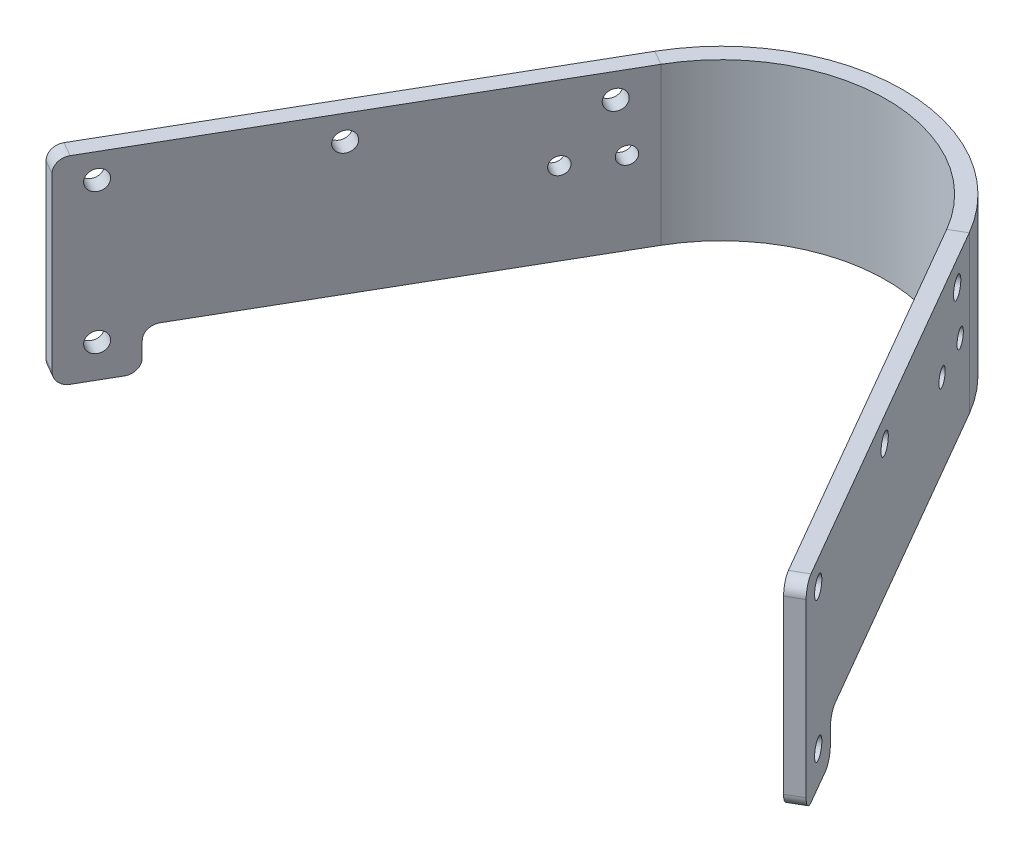
from build123d import *

# Parameters (mm, degrees)
BOSS_EXTRUDE10_DEPTH = 30.1625
SKETCH29_W           = 12.7
SKETCH29_H           = 7.9375
BOSS_EXTRUDE12_DEPTH = 6.35
CUT_EXTRUDE19_REACH  = 181.357
SKETCH30_R           = 1.651
CUT_EXTRUDE23_REACH  = 181.357
SKETCH38_R           = 1.905
FILLET24_R           = 2.54
CONVERT_SOLID1_DEPTH = 38.1


# Read off the part's stored shape, not the designer's step: Convert-Solid1
with BuildPart() as part:
    # Sketch28 → Boss-Extrude10 (new body)
    with BuildSketch(Plane(origin=(0, 38.1, 0), x_dir=(-1, 0, 0), z_dir=(0, -1, 0))):
        with BuildLine():
            Line((32.995567884, 114.3), (75.858067884, 40.059972261))
            Line((75.858067884, 40.059972261), (70.35880657, 36.884972261))
            Line((70.35880657, 36.884972261), (27.49630657, 111.125))
            ThreePointArc((27.49630657, 111.125), (0, 127), (-27.49630657, 111.125))
            Line((-27.49630657, 111.125), (-70.35880657, 36.884972261))
            Line((-70.35880657, 36.884972261), (-75.858067884, 40.059972261))
            Line((-75.858067884, 40.059972261), (-32.995567884, 114.3))
            ThreePointArc((-32.995567884, 114.3), (0, 133.35), (32.995567884, 114.3))
        make_face()
    extrude(amount=BOSS_EXTRUDE10_DEPTH)

    # Sketch29 → Boss-Extrude12 (add)
    with BuildSketch(Plane(origin=(-74.240027739, 0, -42.8625), x_dir=(-0.5, 0, 0.8660254037844387), z_dir=(-0.8660254037844387, 0, -0.5))):
        with Locations((-3.11391971, 3.96875)):
            Rectangle(SKETCH29_W, SKETCH29_H)
    boss_extrude12 = extrude(amount=-BOSS_EXTRUDE12_DEPTH)

    # Sketch30 → Cut-Extrude19 (cut, up to next)
    with BuildSketch(Plane(origin=(-74.240027739, 0, -42.8625), x_dir=(-0.5, 0, 0.8660254037844387), z_dir=(-0.8660254037844387, 0, -0.5)), mode=Mode.PRIVATE) as cut_extrude19_sk1:
        with Locations((-77.72641971, 23.8125)):
            Circle(SKETCH30_R)
    cut_extrude19_tool1 = extrude(cut_extrude19_sk1.sketch, amount=-CUT_EXTRUDE19_REACH, mode=Mode.PRIVATE) & part.part
    # Sketch30 → Cut-Extrude19 (cut, up to next)
    with BuildSketch(Plane(origin=(-74.240027739, 0, -42.8625), x_dir=(-0.5, 0, 0.8660254037844387), z_dir=(-0.8660254037844387, 0, -0.5)), mode=Mode.PRIVATE) as cut_extrude19_sk2:
        with Locations((-68.20141971, 23.8125)):
            Circle(SKETCH30_R)
    cut_extrude19_tool2 = extrude(cut_extrude19_sk2.sketch, amount=-CUT_EXTRUDE19_REACH, mode=Mode.PRIVATE) & part.part
    cut_extrude19_1 = cut_extrude19_tool1.solids().sort_by_distance((-35.376818, 23.8125, -110.175554))[0]
    add(cut_extrude19_1, mode=Mode.SUBTRACT)
    cut_extrude19_2 = cut_extrude19_tool2.solids().sort_by_distance((-40.139318, 23.8125, -101.926662))[0]
    add(cut_extrude19_2, mode=Mode.SUBTRACT)
    cut_extrude19 = cut_extrude19_1 + cut_extrude19_2  # Cut-Extrude19 as one shape, for the pattern or mirror that repeats it

    # Sketch38 → Cut-Extrude23 (cut, up to next)
    with BuildSketch(Plane(origin=(-74.240027739, 0, -42.8625), x_dir=(-0.5, 0, 0.8660254037844387), z_dir=(-0.8660254037844387, 0, -0.5)), mode=Mode.PRIVATE) as cut_extrude23_sk1:
        with Locations((-76.13891971, 33.3375)):
            Circle(SKETCH38_R)
    cut_extrude23_tool1 = extrude(cut_extrude23_sk1.sketch, amount=-CUT_EXTRUDE23_REACH, mode=Mode.PRIVATE) & part.part
    # Sketch38 → Cut-Extrude23 (cut, up to next)
    with BuildSketch(Plane(origin=(-74.240027739, 0, -42.8625), x_dir=(-0.5, 0, 0.8660254037844387), z_dir=(-0.8660254037844387, 0, -0.5)), mode=Mode.PRIVATE) as cut_extrude23_sk2:
        with Locations((-38.03891971, 33.3375)):
            Circle(SKETCH38_R)
    cut_extrude23_tool2 = extrude(cut_extrude23_sk2.sketch, amount=-CUT_EXTRUDE23_REACH, mode=Mode.PRIVATE) & part.part
    # Sketch38 → Cut-Extrude23 (cut, up to next)
    with BuildSketch(Plane(origin=(-74.240027739, 0, -42.8625), x_dir=(-0.5, 0, 0.8660254037844387), z_dir=(-0.8660254037844387, 0, -0.5)), mode=Mode.PRIVATE) as cut_extrude23_sk3:
        with Locations((-3.11391971, 33.3375)):
            Circle(SKETCH38_R)
    cut_extrude23_tool3 = extrude(cut_extrude23_sk3.sketch, amount=-CUT_EXTRUDE23_REACH, mode=Mode.PRIVATE) & part.part
    # Sketch38 → Cut-Extrude23 (cut, up to next)
    with BuildSketch(Plane(origin=(-74.240027739, 0, -42.8625), x_dir=(-0.5, 0, 0.8660254037844387), z_dir=(-0.8660254037844387, 0, -0.5)), mode=Mode.PRIVATE) as cut_extrude23_sk4:
        with Locations((-3.11391971, 6.35)):
            Circle(SKETCH38_R)
    cut_extrude23_tool4 = extrude(cut_extrude23_sk4.sketch, amount=-CUT_EXTRUDE23_REACH, mode=Mode.PRIVATE) & part.part
    cut_extrude23_1 = cut_extrude23_tool1.solids().sort_by_distance((-36.170568, 33.3375, -108.800739))[0]
    add(cut_extrude23_1, mode=Mode.SUBTRACT)
    cut_extrude23_2 = cut_extrude23_tool2.solids().sort_by_distance((-55.220568, 33.3375, -75.805171))[0]
    add(cut_extrude23_2, mode=Mode.SUBTRACT)
    cut_extrude23_3 = cut_extrude23_tool3.solids().sort_by_distance((-72.683068, 33.3375, -45.559234))[0]
    add(cut_extrude23_3, mode=Mode.SUBTRACT)
    cut_extrude23_4 = cut_extrude23_tool4.solids().sort_by_distance((-72.683068, 6.35, -45.559234))[0]
    add(cut_extrude23_4, mode=Mode.SUBTRACT)
    cut_extrude23 = cut_extrude23_1 + cut_extrude23_2 + cut_extrude23_3 + cut_extrude23_4  # Cut-Extrude23 as one shape, for the pattern or mirror that repeats it

    # Mirror7: Boss-Extrude12, Cut-Extrude19, Cut-Extrude23 across plane
    add(boss_extrude12.mirror(Plane(origin=(0, 0, 0), x_dir=(0, 0, 1), z_dir=(1, 0, 0))))
    add(cut_extrude19.mirror(Plane(origin=(0, 0, 0), x_dir=(0, 0, 1), z_dir=(1, 0, 0))), mode=Mode.SUBTRACT)
    add(cut_extrude23.mirror(Plane(origin=(0, 0, 0), x_dir=(0, 0, 1), z_dir=(1, 0, 0))), mode=Mode.SUBTRACT)

    # Fillet24
    fillet24_edges = [part.edges().sort_by_distance(p)[0] for p in [
        (73.108437227, 38.1, -38.472472261),
        (-73.108437227, 0, -38.472472261),
        (-66.758437227, 0, -49.470994889),
        (-66.758437227, 7.9375, -49.470994889),
        (73.108437227, 0, -38.472472261),
        (66.758437227, 7.9375, -49.470994889),
        (66.758437227, 0, -49.470994889),
        (-73.108437227, 38.1, -38.472472261),
    ]]
    fillet(fillet24_edges, radius=FILLET24_R)

    # Convert-Solid1 outline → Convert-Solid1 (cut)
    with BuildSketch(Plane(origin=(0, 0, 0), x_dir=(1, 0, 0), z_dir=(0, 1, 0))):
        with BuildLine():
            ThreePointArc((-30.245937227, 112.7125), (0, 130.175), (30.245937227, 112.7125))
            Line((30.245937227, 112.7125), (73.108437227, 38.472472261))
            Line((73.108437227, 38.472472261), (75.858067884, 40.059972261))
            Line((75.858067884, 40.059972261), (32.995567884, 114.3))
            ThreePointArc((32.995567884, 114.3), (0, 133.35), (-32.995567884, 114.3))
            Line((-32.995567884, 114.3), (-75.858067884, 40.059972261))
            Line((-75.858067884, 40.059972261), (-73.108437227, 38.472472261))
            Line((-73.108437227, 38.472472261), (-30.245937227, 112.7125))
        make_face()
    extrude(amount=CONVERT_SOLID1_DEPTH, mode=Mode.SUBTRACT)


solid = part.part
